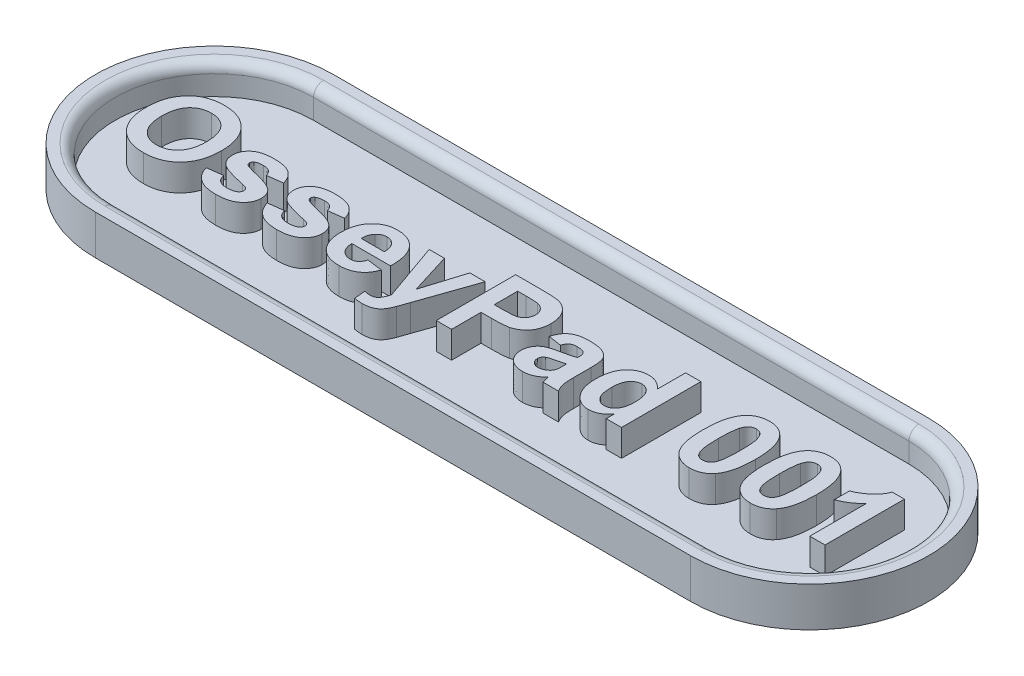
from build123d import *

# Parameters (mm, degrees)
BOSS_EXTRUDE1_DEPTH = 2
CUT_EXTRUDE1_DEPTH  = 1.5
BOSS_EXTRUDE2_DEPTH = 1.35
FILLET1_R           = 0.5


with BuildPart() as part:
    # Sketch1 → Boss-Extrude1 (new body)
    with BuildSketch(Plane(origin=(0, 0, 0), x_dir=(1, 0, 0), z_dir=(0, 1, 0))):
        with BuildLine():
            Line((-15, 6), (15, 6))
            ThreePointArc((15, 6), (21, 0), (15, -6))
            Line((15, -6), (-15, -6))
            ThreePointArc((-15, -6), (-21, 0), (-15, 6))
        make_face()
    extrude(amount=BOSS_EXTRUDE1_DEPTH)

    # Sketch2 → Cut-Extrude1 (cut)
    with BuildSketch(Plane(origin=(0, 2, 0), x_dir=(1, 0, 0), z_dir=(0, 1, 0))):
        with BuildLine():
            Line((-15, 5), (15, 5))
            ThreePointArc((15, 5), (20, 0), (15, -5))
            Line((15, -5), (-15, -5))
            ThreePointArc((-15, -5), (-20, 0), (-15, 5))
        make_face()
    extrude(amount=-CUT_EXTRUDE1_DEPTH, mode=Mode.SUBTRACT)

    # Sketch3 → Boss-Extrude2 (add)
    # profile 1 of 11: a face of its own
    with BuildSketch(Plane(origin=(0, 0.5, 0), x_dir=(1, 0, 0), z_dir=(0, 1, 0))):
        with BuildLine():
            add(Edge.make_bspline(
                [(-18.435897436, -0.019038462), (-18.435614372, 0.030391888), (-18.435058472, 0.127466713), (-18.425426006, 0.269879126), (-18.412729667, 0.406386741), (-18.392053698, 0.536452624), (-18.36773121, 0.660685527), (-18.337310232, 0.779048573), (-18.300663727, 0.891126668), (-18.271511143, 0.96268732), (-18.257211538, 0.997788462)],
                knots=[0, 0, 0, 0, 1.141009212, 2.240794809, 3.294380675, 4.305229195, 5.280013876, 6.216333343, 7.125095522, 8, 8, 8, 8], degree=3))
            add(Edge.make_bspline(
                [(-18.257211538, 0.997788462), (-18.233837113, 1.047688799), (-18.187363182, 1.146902566), (-18.10105379, 1.287099593), (-18.003227182, 1.41931675), (-17.894688739, 1.542860898), (-17.778209481, 1.655872151), (-17.653239913, 1.752593511), (-17.52421983, 1.836291465), (-17.43245726, 1.87838656), (-17.387019231, 1.899230769)],
                knots=[0, 0, 0, 0, 1.031372299, 2.050613973, 3.077158538, 4.108712802, 5.127684358, 6.111366908, 7.06480644, 8, 8, 8, 8], degree=3))
            add(Edge.make_bspline(
                [(-17.387019231, 1.899230769), (-17.356176067, 1.911881947), (-17.293834169, 1.937453202), (-17.196947521, 1.969367469), (-17.09638472, 1.995296368), (-16.992873129, 2.018473783), (-16.885407739, 2.034455374), (-16.774856913, 2.047855388), (-16.660615646, 2.054878568), (-16.583341404, 2.055809135), (-16.544070513, 2.056282051)],
                knots=[0, 0, 0, 0, 0.92659354, 1.872881803, 2.832850937, 3.813025581, 4.820167273, 5.851730198, 6.908245912, 8, 8, 8, 8], degree=3))
            add(Edge.make_bspline(
                [(-16.544070513, 2.056282051), (-16.473752941, 2.054519421), (-16.336140487, 2.051069928), (-16.135127335, 2.026154655), (-15.944907861, 1.984082923), (-15.76612596, 1.923273675), (-15.597240232, 1.847260796), (-15.439562816, 1.752975475), (-15.292860348, 1.641438169), (-15.157416176, 1.51417841), (-15.035438998, 1.371417983), (-14.929207009, 1.214490481), (-14.840092733, 1.044131281), (-14.766701981, 0.860810413), (-14.710306718, 0.663929092), (-14.669561193, 0.454042839), (-14.645355053, 0.230997055), (-14.642494663, 0.077977768), (-14.641025641, -0.000608974)],
                knots=[0, 0, 0, 0, 1.064641025, 2.083517118, 3.061799897, 4.009540929, 4.938075217, 5.861300345, 6.78508344, 7.723570974, 8.670267188, 9.622657076, 10.586935816, 11.576069104, 12.607749008, 13.683335114, 14.81022093, 16, 16, 16, 16], degree=3))
            add(Edge.make_bspline(
                [(-14.641025641, -0.000608974), (-14.642460733, -0.078669488), (-14.645254589, -0.230638725), (-14.669912552, -0.451934259), (-14.708968828, -0.660290436), (-14.766728631, -0.855231293), (-14.837928977, -1.038244361), (-14.927960262, -1.207149806), (-15.031967432, -1.36418805), (-15.153771364, -1.505410123), (-15.286935934, -1.633400225), (-15.433452317, -1.743633941), (-15.589981919, -1.838047013), (-15.757946851, -1.914279558), (-15.936252349, -1.97383646), (-16.125480301, -2.016231483), (-16.325727758, -2.041050879), (-16.462804031, -2.044512896), (-16.532852564, -2.046282051)],
                knots=[0, 0, 0, 0, 1.18845052, 2.313691126, 3.386664782, 4.412527756, 5.405809582, 6.372003093, 7.321919452, 8.268293321, 9.206237639, 10.129603466, 11.054616372, 11.9847576, 12.932764752, 13.912672021, 14.933336461, 16, 16, 16, 16], degree=3))
            add(Edge.make_bspline(
                [(-16.532852564, -2.046282051), (-16.603701235, -2.044508814), (-16.742372437, -2.041038078), (-16.94475572, -2.01629423), (-17.135862082, -1.973885252), (-17.315555438, -1.914118857), (-17.48506133, -1.839044378), (-17.642814776, -1.745596071), (-17.788902977, -1.634664224), (-17.923180215, -1.508180678), (-18.044908831, -1.367373801), (-18.148768325, -1.211345269), (-18.238804305, -1.044089607), (-18.310378988, -0.863073293), (-18.367820729, -0.670158752), (-18.406972441, -0.464235937), (-18.431678084, -0.245871605), (-18.434465278, -0.096031531), (-18.435897436, -0.019038462)],
                knots=[0, 0, 0, 0, 1.080878253, 2.11558926, 3.1052859, 4.062802436, 5.000434901, 5.928596448, 6.853693179, 7.793554778, 8.738606028, 9.68692032, 10.647726704, 11.63151566, 12.651483354, 13.714466703, 14.825613081, 16, 16, 16, 16], degree=3))
        make_face()
        with BuildLine():
            add(Edge.make_bspline(
                [(-17.666666667, 0.007403846), (-17.665898215, -0.047926721), (-17.664410122, -0.155073313), (-17.648559966, -0.310593997), (-17.62450608, -0.455984026), (-17.589131307, -0.591078385), (-17.544442015, -0.715974806), (-17.489688367, -0.830777762), (-17.425096639, -0.935658241), (-17.348996163, -1.028402068), (-17.266661415, -1.111204428), (-17.1777884, -1.182849353), (-17.084033397, -1.244514577), (-16.983774163, -1.293199063), (-16.879097269, -1.331835528), (-16.76918945, -1.360483053), (-16.653504218, -1.376213357), (-16.574563827, -1.378469211), (-16.534455128, -1.379615385)],
                knots=[0, 0, 0, 0, 1.313550922, 2.543666373, 3.708465049, 4.810029406, 5.85539231, 6.85404609, 7.825601258, 8.772642133, 9.696587791, 10.59409323, 11.479048685, 12.35559886, 13.234601248, 14.125357077, 15.047515647, 16, 16, 16, 16], degree=3))
            add(Edge.make_bspline(
                [(-16.534455128, -1.379615385), (-16.494341027, -1.378492434), (-16.415390001, -1.376282287), (-16.299846911, -1.360230356), (-16.189721284, -1.332810725), (-16.08546024, -1.294372249), (-15.986588573, -1.244914713), (-15.8931924, -1.184631894), (-15.80581008, -1.112661016), (-15.723564952, -1.031061566), (-15.649518611, -0.937701745), (-15.585476829, -0.832839365), (-15.530750158, -0.717340126), (-15.486056159, -0.591160819), (-15.451551967, -0.454064039), (-15.428479779, -0.305977248), (-15.412501451, -0.147323872), (-15.411019428, -0.037777837), (-15.41025641, 0.018621795)],
                knots=[0, 0, 0, 0, 0.949153107, 1.868086493, 2.754172764, 3.630100905, 4.492260106, 5.365378617, 6.254840125, 7.166615376, 8.102436631, 9.067266169, 10.06813181, 11.121736829, 12.23011542, 13.408501285, 14.665770308, 16, 16, 16, 16], degree=3))
            add(Edge.make_bspline(
                [(-15.41025641, 0.018621795), (-15.411118249, 0.074476858), (-15.41278728, 0.182645496), (-15.427322822, 0.339296022), (-15.451129355, 0.485035309), (-15.484223065, 0.619825604), (-15.527958483, 0.743688626), (-15.580195321, 0.85696309), (-15.643357078, 0.959057199), (-15.715795873, 1.049918093), (-15.795952736, 1.129893197), (-15.882465829, 1.199907974), (-15.975826687, 1.258164525), (-16.075124125, 1.307179509), (-16.181391931, 1.343543547), (-16.293550177, 1.37006717), (-16.411916263, 1.386400457), (-16.493002947, 1.388527846), (-16.534455128, 1.389615385)],
                knots=[0, 0, 0, 0, 1.332337092, 2.580197383, 3.749299508, 4.852775005, 5.886662144, 6.878700295, 7.822989687, 8.743523536, 9.644687758, 10.519443927, 11.392806431, 12.264866173, 13.155606721, 14.065961015, 15.011303331, 16, 16, 16, 16], degree=3))
            add(Edge.make_bspline(
                [(-16.534455128, 1.389615385), (-16.575912549, 1.388544575), (-16.657009482, 1.38644991), (-16.775560073, 1.369846201), (-16.888071654, 1.344112915), (-16.994324441, 1.305672486), (-17.09448679, 1.257128201), (-17.18818823, 1.196923612), (-17.276167098, 1.127027656), (-17.357042143, 1.045839945), (-17.430654676, 0.954183395), (-17.493846849, 0.850841799), (-17.54773206, 0.736943776), (-17.591941752, 0.612152179), (-17.624714805, 0.476123712), (-17.649903624, 0.32977257), (-17.66404873, 0.17221295), (-17.665775266, 0.063520944), (-17.666666667, 0.007403846)],
                knots=[0, 0, 0, 0, 0.981996942, 1.920933313, 2.83127778, 3.712125466, 4.592427284, 5.463259035, 6.34592384, 7.249932058, 8.173122297, 9.125107726, 10.113123258, 11.154048744, 12.256187849, 13.424658091, 14.670364834, 16, 16, 16, 16], degree=3))
        make_face(mode=Mode.SUBTRACT)
    # profile 2 of 11: a face of its own
    with BuildSketch(Plane(origin=(0, 0.5, 0), x_dir=(1, 0, 0), z_dir=(0, 1, 0))):
        with BuildLine():
            Line((-14.282051282, -1.123205128), (-13.512820513, -1.020641026))
            add(Edge.make_bspline(
                [(-13.512820513, -1.020641026), (-13.503588992, -1.056569262), (-13.485806776, -1.125776019), (-13.440765362, -1.219861636), (-13.384300764, -1.301338096), (-13.313151957, -1.368206503), (-13.227776206, -1.420848967), (-13.126905802, -1.455961432), (-13.011987496, -1.478973479), (-12.930147888, -1.48107304), (-12.887019231, -1.482179487)],
                knots=[0, 0, 0, 0, 1.039319445, 2.001988807, 2.911187514, 3.807680854, 4.723381073, 5.705509029, 6.790826147, 8, 8, 8, 8], degree=3))
            add(Edge.make_bspline(
                [(-12.887019231, -1.482179487), (-12.839880641, -1.481347743), (-12.75121902, -1.479783339), (-12.62828516, -1.458072396), (-12.521475317, -1.427913994), (-12.462819321, -1.391852021), (-12.435096154, -1.374807692)],
                knots=[0, 0, 0, 0, 1.198418162, 2.254070348, 3.174803892, 4, 4, 4, 4], degree=3))
            add(Edge.make_bspline(
                [(-12.435096154, -1.374807692), (-12.419283009, -1.361970451), (-12.388529775, -1.337004722), (-12.357321655, -1.286774029), (-12.336548638, -1.231639984), (-12.33442565, -1.192316164), (-12.333333333, -1.172083333)],
                knots=[0, 0, 0, 0, 1.030872991, 2.004830756, 2.973448591, 4, 4, 4, 4], degree=3))
            add(Edge.make_bspline(
                [(-12.333333333, -1.172083333), (-12.333856942, -1.158391082), (-12.334879677, -1.131646774), (-12.345581427, -1.093401245), (-12.363543317, -1.058834225), (-12.380204244, -1.039316175), (-12.388621795, -1.029455128)],
                knots=[0, 0, 0, 0, 1.045349703, 2.041822997, 3.010676005, 4, 4, 4, 4], degree=3))
            add(Edge.make_bspline(
                [(-12.388621795, -1.029455128), (-12.400894011, -1.020176849), (-12.429419818, -0.998610215), (-12.486486698, -0.974387347), (-12.560350945, -0.950824332), (-12.616066184, -0.937439697), (-12.646634615, -0.930096154)],
                knots=[0, 0, 0, 0, 0.66031085, 1.534841007, 2.647478808, 4, 4, 4, 4], degree=3))
            add(Edge.make_bspline(
                [(-12.646634615, -0.930096154), (-12.721227082, -0.913856878), (-12.863234827, -0.882940846), (-13.065131088, -0.833755569), (-13.245525882, -0.786146435), (-13.404870539, -0.739742648), (-13.542613402, -0.694923944), (-13.658764318, -0.649630758), (-13.754504942, -0.607412605), (-13.808485703, -0.574545067), (-13.832532051, -0.559903846)],
                knots=[0, 0, 0, 0, 1.469089687, 2.796825535, 3.998745421, 5.059265209, 5.990657066, 6.784841839, 7.458693894, 8, 8, 8, 8], degree=3))
            add(Edge.make_bspline(
                [(-13.832532051, -0.559903846), (-13.859964203, -0.539907491), (-13.913524548, -0.500865288), (-13.984866571, -0.433639585), (-14.045359316, -0.360546964), (-14.094819935, -0.281361418), (-14.132571634, -0.196272563), (-14.160176726, -0.105675334), (-14.176162186, -0.00918622), (-14.178365399, 0.057025188), (-14.179487179, 0.090737179)],
                knots=[0, 0, 0, 0, 1.056974227, 2.063706289, 3.045111424, 4.005796011, 4.963194591, 5.937303459, 6.949763919, 8, 8, 8, 8], degree=3))
            add(Edge.make_bspline(
                [(-14.179487179, 0.090737179), (-14.178506217, 0.121498882), (-14.176568673, 0.18225772), (-14.162944075, 0.271321), (-14.139429164, 0.356527801), (-14.106303269, 0.437978804), (-14.063838597, 0.515676427), (-14.01177776, 0.589438857), (-13.95059227, 0.658997097), (-13.880735197, 0.725331941), (-13.800596308, 0.785410533), (-13.709942495, 0.837752256), (-13.608876063, 0.881946689), (-13.497571662, 0.917352533), (-13.376215124, 0.945612476), (-13.244644555, 0.965105296), (-13.102793158, 0.977248281), (-13.004833611, 0.978640938), (-12.954326923, 0.979358974)],
                knots=[0, 0, 0, 0, 0.866638136, 1.711736386, 2.531524902, 3.351865931, 4.183724929, 5.020979167, 5.890357771, 6.790086018, 7.73080449, 8.705352504, 9.73310627, 10.832638366, 11.99182341, 13.240303911, 14.577136024, 16, 16, 16, 16], degree=3))
            add(Edge.make_bspline(
                [(-12.954326923, 0.979358974), (-12.906231226, 0.978787995), (-12.812876493, 0.977679713), (-12.67781573, 0.967920626), (-12.552139255, 0.952611043), (-12.436468928, 0.928745967), (-12.329557347, 0.9011226), (-12.232985185, 0.864147181), (-12.144787817, 0.823597147), (-12.067292993, 0.773348808), (-11.996401025, 0.718487231), (-11.932465755, 0.656484776), (-11.873956769, 0.588615274), (-11.819228994, 0.51594747), (-11.773635709, 0.43487875), (-11.731460942, 0.349008459), (-11.695237781, 0.25654036), (-11.676321498, 0.191859255), (-11.666666667, 0.158846154)],
                knots=[0, 0, 0, 0, 1.380550213, 2.679676202, 3.885648221, 5.011984379, 6.068504557, 7.051214125, 7.977245523, 8.849391706, 9.696088241, 10.547493682, 11.400830533, 12.26732929, 13.153751704, 14.065965736, 15.012872933, 16, 16, 16, 16], degree=3))
            Line((-11.666666667, 0.158846154), (-12.435897436, 0.056282051))
            add(Edge.make_bspline(
                [(-12.435897436, 0.056282051), (-12.44353246, 0.083854631), (-12.458354073, 0.137380345), (-12.494918792, 0.209843608), (-12.540535161, 0.272350335), (-12.59595556, 0.324557028), (-12.662601034, 0.367028168), (-12.742652446, 0.394753661), (-12.834391954, 0.412839487), (-12.899739602, 0.414420424), (-12.934294872, 0.41525641)],
                knots=[0, 0, 0, 0, 1.018425325, 1.977034519, 2.876390575, 3.766006025, 4.677889232, 5.672509542, 6.769243204, 8, 8, 8, 8], degree=3))
            add(Edge.make_bspline(
                [(-12.934294872, 0.41525641), (-12.977124797, 0.414699738), (-13.056725864, 0.413665142), (-13.16586366, 0.397183454), (-13.257824114, 0.374295727), (-13.307346951, 0.345273665), (-13.330128205, 0.331923077)],
                knots=[0, 0, 0, 0, 1.252081424, 2.327041614, 3.230413832, 4, 4, 4, 4], degree=3))
            add(Edge.make_bspline(
                [(-13.330128205, 0.331923077), (-13.342456433, 0.321788731), (-13.366113605, 0.302341495), (-13.391654636, 0.264654654), (-13.407877318, 0.222890209), (-13.409454378, 0.193184234), (-13.41025641, 0.178076923)],
                knots=[0, 0, 0, 0, 1.057832138, 2.029920023, 2.998093444, 4, 4, 4, 4], degree=3))
            add(Edge.make_bspline(
                [(-13.41025641, 0.178076923), (-13.40928165, 0.165135586), (-13.407337559, 0.13932501), (-13.392990107, 0.102271577), (-13.36903332, 0.068392092), (-13.347181778, 0.050453113), (-13.335737179, 0.041057692)],
                knots=[0, 0, 0, 0, 0.958252903, 1.911167308, 2.905987877, 4, 4, 4, 4], degree=3))
            add(Edge.make_bspline(
                [(-13.335737179, 0.041057692), (-13.32494537, 0.034084736), (-13.299162077, 0.01742527), (-13.249511898, -0.002773967), (-13.18505873, -0.026047872), (-13.104980233, -0.051235356), (-13.009711848, -0.079347287), (-12.89880707, -0.10890514), (-12.772311342, -0.139825148), (-12.634515803, -0.17219658), (-12.49437076, -0.205708932), (-12.361338797, -0.242193781), (-12.239728485, -0.281613621), (-12.129457938, -0.322826732), (-12.030304296, -0.366366142), (-11.942020126, -0.41061892), (-11.864871621, -0.457567942), (-11.820191691, -0.493218242), (-11.798878205, -0.510224359)],
                knots=[0, 0, 0, 0, 0.374473465, 0.894674728, 1.558250729, 2.377018991, 3.344303564, 4.458456515, 5.727543487, 7.146141891, 8.591136569, 9.934411183, 11.172377707, 12.322386231, 13.369924362, 14.332482298, 15.204550818, 16, 16, 16, 16], degree=3))
            add(Edge.make_bspline(
                [(-11.798878205, -0.510224359), (-11.779945602, -0.527644828), (-11.742536172, -0.562066393), (-11.69542515, -0.621833436), (-11.653661961, -0.685071569), (-11.621326792, -0.754462947), (-11.595250362, -0.828189433), (-11.576771333, -0.907148599), (-11.566753507, -0.991269367), (-11.564997898, -1.048928191), (-11.564102564, -1.078333333)],
                knots=[0, 0, 0, 0, 0.971012965, 1.9186502, 2.868006896, 3.82989672, 4.803792202, 5.820095146, 6.888280979, 8, 8, 8, 8], degree=3))
            add(Edge.make_bspline(
                [(-11.564102564, -1.078333333), (-11.565295587, -1.110969704), (-11.567645823, -1.175262837), (-11.582875331, -1.270113279), (-11.609989246, -1.360922238), (-11.645666238, -1.449065327), (-11.693816672, -1.532829726), (-11.751948954, -1.613022854), (-11.819518303, -1.690582731), (-11.897996412, -1.763354566), (-11.987072109, -1.829811392), (-12.085901593, -1.888678871), (-12.195218434, -1.937522003), (-12.314399095, -1.977516026), (-12.443694139, -2.008375551), (-12.582931045, -2.030888881), (-12.732147542, -2.043256241), (-12.834914261, -2.045253714), (-12.887820513, -2.046282051)],
                knots=[0, 0, 0, 0, 0.853005228, 1.680406763, 2.502135431, 3.325285981, 4.159928718, 5.020072903, 5.910500533, 6.844018396, 7.811498054, 8.809909951, 9.84399402, 10.934451331, 12.090792638, 13.314110396, 14.617253208, 16, 16, 16, 16], degree=3))
            add(Edge.make_bspline(
                [(-12.887820513, -2.046282051), (-12.936181474, -2.045452418), (-13.030366908, -2.043836665), (-13.167786588, -2.03305919), (-13.29724265, -2.0126671), (-13.419121567, -1.98570948), (-13.533495342, -1.951546885), (-13.639918269, -1.908814847), (-13.738889811, -1.858532218), (-13.829524457, -1.799749942), (-13.912359977, -1.734491454), (-13.987982542, -1.66375026), (-14.056500913, -1.587622814), (-14.116484012, -1.50536249), (-14.170071844, -1.418252796), (-14.215427969, -1.325350699), (-14.253759352, -1.226740298), (-14.27251028, -1.158120713), (-14.282051282, -1.123205128)],
                knots=[0, 0, 0, 0, 1.275954772, 2.484986887, 3.63311568, 4.730696379, 5.776212371, 6.778566547, 7.752400714, 8.700396387, 9.623767345, 10.531135067, 11.42942751, 12.321590653, 13.213503293, 14.124285009, 15.045583181, 16, 16, 16, 16], degree=3))
        make_face()
    # profile 3 of 11: a face of its own
    with BuildSketch(Plane(origin=(0, 0.5, 0), x_dir=(1, 0, 0), z_dir=(0, 1, 0))):
        with BuildLine():
            Line((-11.205128205, -1.123205128), (-10.435897436, -1.020641026))
            add(Edge.make_bspline(
                [(-10.435897436, -1.020641026), (-10.426665915, -1.056569262), (-10.408883699, -1.125776019), (-10.363842285, -1.219861636), (-10.307377687, -1.301338096), (-10.23622888, -1.368206503), (-10.150853129, -1.420848967), (-10.049982725, -1.455961432), (-9.935064419, -1.478973479), (-9.853224811, -1.48107304), (-9.810096154, -1.482179487)],
                knots=[0, 0, 0, 0, 1.039319445, 2.001988807, 2.911187514, 3.807680854, 4.723381073, 5.705509029, 6.790826147, 8, 8, 8, 8], degree=3))
            add(Edge.make_bspline(
                [(-9.810096154, -1.482179487), (-9.762957564, -1.481347743), (-9.674295943, -1.479783339), (-9.551362083, -1.458072396), (-9.44455224, -1.427913994), (-9.385896244, -1.391852021), (-9.358173077, -1.374807692)],
                knots=[0, 0, 0, 0, 1.198418162, 2.254070348, 3.174803892, 4, 4, 4, 4], degree=3))
            add(Edge.make_bspline(
                [(-9.358173077, -1.374807692), (-9.342359932, -1.361970451), (-9.311606698, -1.337004722), (-9.280398578, -1.286774029), (-9.259625561, -1.231639984), (-9.257502573, -1.192316164), (-9.256410256, -1.172083333)],
                knots=[0, 0, 0, 0, 1.030872991, 2.004830756, 2.973448591, 4, 4, 4, 4], degree=3))
            add(Edge.make_bspline(
                [(-9.256410256, -1.172083333), (-9.256933865, -1.158391082), (-9.2579566, -1.131646774), (-9.26865835, -1.093401245), (-9.28662024, -1.058834225), (-9.303281167, -1.039316175), (-9.311698718, -1.029455128)],
                knots=[0, 0, 0, 0, 1.045349703, 2.041822997, 3.010676005, 4, 4, 4, 4], degree=3))
            add(Edge.make_bspline(
                [(-9.311698718, -1.029455128), (-9.323970934, -1.020176849), (-9.352496741, -0.998610215), (-9.409563621, -0.974387347), (-9.483427868, -0.950824332), (-9.539143107, -0.937439697), (-9.569711538, -0.930096154)],
                knots=[0, 0, 0, 0, 0.66031085, 1.534841007, 2.647478808, 4, 4, 4, 4], degree=3))
            add(Edge.make_bspline(
                [(-9.569711538, -0.930096154), (-9.644304005, -0.913856878), (-9.78631175, -0.882940846), (-9.988208011, -0.833755569), (-10.168602805, -0.786146435), (-10.327947462, -0.739742648), (-10.465690325, -0.694923944), (-10.581841241, -0.649630758), (-10.677581865, -0.607412605), (-10.731562627, -0.574545067), (-10.755608974, -0.559903846)],
                knots=[0, 0, 0, 0, 1.469089687, 2.796825535, 3.998745421, 5.059265209, 5.990657066, 6.784841839, 7.458693894, 8, 8, 8, 8], degree=3))
            add(Edge.make_bspline(
                [(-10.755608974, -0.559903846), (-10.783041126, -0.539907491), (-10.836601471, -0.500865288), (-10.907943494, -0.433639585), (-10.968436239, -0.360546964), (-11.017896858, -0.281361418), (-11.055648557, -0.196272563), (-11.083253649, -0.105675334), (-11.09923911, -0.00918622), (-11.101442322, 0.057025188), (-11.102564103, 0.090737179)],
                knots=[0, 0, 0, 0, 1.056974227, 2.063706289, 3.045111424, 4.005796011, 4.963194591, 5.937303459, 6.949763919, 8, 8, 8, 8], degree=3))
            add(Edge.make_bspline(
                [(-11.102564103, 0.090737179), (-11.10158314, 0.121498882), (-11.099645596, 0.18225772), (-11.086020998, 0.271321), (-11.062506087, 0.356527801), (-11.029380192, 0.437978804), (-10.98691552, 0.515676427), (-10.934854683, 0.589438857), (-10.873669193, 0.658997097), (-10.80381212, 0.725331941), (-10.723673231, 0.785410533), (-10.633019418, 0.837752256), (-10.531952987, 0.881946689), (-10.420648585, 0.917352533), (-10.299292047, 0.945612476), (-10.167721478, 0.965105296), (-10.025870081, 0.977248281), (-9.927910534, 0.978640938), (-9.877403846, 0.979358974)],
                knots=[0, 0, 0, 0, 0.866638136, 1.711736386, 2.531524902, 3.351865931, 4.183724929, 5.020979167, 5.890357771, 6.790086018, 7.73080449, 8.705352504, 9.73310627, 10.832638366, 11.99182341, 13.240303911, 14.577136024, 16, 16, 16, 16], degree=3))
            add(Edge.make_bspline(
                [(-9.877403846, 0.979358974), (-9.829308149, 0.978787995), (-9.735953416, 0.977679713), (-9.600892653, 0.967920626), (-9.475216179, 0.952611043), (-9.359545852, 0.928745967), (-9.252634271, 0.9011226), (-9.156062108, 0.864147181), (-9.06786474, 0.823597147), (-8.990369916, 0.773348808), (-8.919477948, 0.718487231), (-8.855542678, 0.656484776), (-8.797033692, 0.588615274), (-8.742305917, 0.51594747), (-8.696712633, 0.43487875), (-8.654537865, 0.349008459), (-8.618314704, 0.25654036), (-8.599398421, 0.191859255), (-8.58974359, 0.158846154)],
                knots=[0, 0, 0, 0, 1.380550213, 2.679676202, 3.885648221, 5.011984379, 6.068504557, 7.051214125, 7.977245523, 8.849391706, 9.696088241, 10.547493682, 11.400830533, 12.26732929, 13.153751704, 14.065965736, 15.012872933, 16, 16, 16, 16], degree=3))
            Line((-8.58974359, 0.158846154), (-9.358974359, 0.056282051))
            add(Edge.make_bspline(
                [(-9.358974359, 0.056282051), (-9.366609383, 0.083854631), (-9.381430996, 0.137380345), (-9.417995715, 0.209843608), (-9.463612084, 0.272350335), (-9.519032483, 0.324557028), (-9.585677957, 0.367028168), (-9.665729369, 0.394753661), (-9.757468877, 0.412839487), (-9.822816525, 0.414420424), (-9.857371795, 0.41525641)],
                knots=[0, 0, 0, 0, 1.018425325, 1.977034519, 2.876390575, 3.766006025, 4.677889232, 5.672509542, 6.769243204, 8, 8, 8, 8], degree=3))
            add(Edge.make_bspline(
                [(-9.857371795, 0.41525641), (-9.90020172, 0.414699738), (-9.979802787, 0.413665142), (-10.088940583, 0.397183454), (-10.180901037, 0.374295727), (-10.230423874, 0.345273665), (-10.253205128, 0.331923077)],
                knots=[0, 0, 0, 0, 1.252081424, 2.327041614, 3.230413832, 4, 4, 4, 4], degree=3))
            add(Edge.make_bspline(
                [(-10.253205128, 0.331923077), (-10.265533356, 0.321788731), (-10.289190529, 0.302341495), (-10.314731559, 0.264654654), (-10.330954241, 0.222890209), (-10.332531301, 0.193184234), (-10.333333333, 0.178076923)],
                knots=[0, 0, 0, 0, 1.057832138, 2.029920023, 2.998093444, 4, 4, 4, 4], degree=3))
            add(Edge.make_bspline(
                [(-10.333333333, 0.178076923), (-10.332358573, 0.165135586), (-10.330414482, 0.13932501), (-10.31606703, 0.102271577), (-10.292110243, 0.068392092), (-10.270258701, 0.050453113), (-10.258814103, 0.041057692)],
                knots=[0, 0, 0, 0, 0.958252903, 1.911167308, 2.905987877, 4, 4, 4, 4], degree=3))
            add(Edge.make_bspline(
                [(-10.258814103, 0.041057692), (-10.248022293, 0.034084736), (-10.222239, 0.01742527), (-10.172588821, -0.002773967), (-10.108135653, -0.026047872), (-10.028057156, -0.051235356), (-9.932788771, -0.079347287), (-9.821883993, -0.10890514), (-9.695388266, -0.139825148), (-9.557592726, -0.17219658), (-9.417447683, -0.205708932), (-9.28441572, -0.242193781), (-9.162805408, -0.281613621), (-9.052534861, -0.322826732), (-8.953381219, -0.366366142), (-8.865097049, -0.41061892), (-8.787948544, -0.457567942), (-8.743268614, -0.493218242), (-8.721955128, -0.510224359)],
                knots=[0, 0, 0, 0, 0.374473465, 0.894674728, 1.558250729, 2.377018991, 3.344303564, 4.458456515, 5.727543487, 7.146141891, 8.591136569, 9.934411183, 11.172377707, 12.322386231, 13.369924362, 14.332482298, 15.204550818, 16, 16, 16, 16], degree=3))
            add(Edge.make_bspline(
                [(-8.721955128, -0.510224359), (-8.703022526, -0.527644828), (-8.665613095, -0.562066393), (-8.618502073, -0.621833436), (-8.576738884, -0.685071569), (-8.544403716, -0.754462947), (-8.518327285, -0.828189433), (-8.499848256, -0.907148599), (-8.48983043, -0.991269367), (-8.488074821, -1.048928191), (-8.487179487, -1.078333333)],
                knots=[0, 0, 0, 0, 0.971012965, 1.9186502, 2.868006896, 3.82989672, 4.803792202, 5.820095146, 6.888280979, 8, 8, 8, 8], degree=3))
            add(Edge.make_bspline(
                [(-8.487179487, -1.078333333), (-8.48837251, -1.110969704), (-8.490722746, -1.175262837), (-8.505952254, -1.270113279), (-8.533066169, -1.360922238), (-8.568743161, -1.449065327), (-8.616893595, -1.532829726), (-8.675025877, -1.613022854), (-8.742595226, -1.690582731), (-8.821073335, -1.763354566), (-8.910149032, -1.829811392), (-9.008978516, -1.888678871), (-9.118295357, -1.937522003), (-9.237476018, -1.977516026), (-9.366771062, -2.008375551), (-9.506007968, -2.030888881), (-9.655224465, -2.043256241), (-9.757991184, -2.045253714), (-9.810897436, -2.046282051)],
                knots=[0, 0, 0, 0, 0.853005228, 1.680406763, 2.502135431, 3.325285981, 4.159928718, 5.020072903, 5.910500533, 6.844018396, 7.811498054, 8.809909951, 9.84399402, 10.934451331, 12.090792638, 13.314110396, 14.617253208, 16, 16, 16, 16], degree=3))
            add(Edge.make_bspline(
                [(-9.810897436, -2.046282051), (-9.859258397, -2.045452418), (-9.953443831, -2.043836665), (-10.090863511, -2.03305919), (-10.220319573, -2.0126671), (-10.34219849, -1.98570948), (-10.456572265, -1.951546885), (-10.562995193, -1.908814847), (-10.661966734, -1.858532218), (-10.75260138, -1.799749942), (-10.8354369, -1.734491454), (-10.911059465, -1.66375026), (-10.979577836, -1.587622814), (-11.039560935, -1.50536249), (-11.093148767, -1.418252796), (-11.138504892, -1.325350699), (-11.176836275, -1.226740298), (-11.195587203, -1.158120713), (-11.205128205, -1.123205128)],
                knots=[0, 0, 0, 0, 1.275954772, 2.484986887, 3.63311568, 4.730696379, 5.776212371, 6.778566547, 7.752400714, 8.700396387, 9.623767345, 10.531135067, 11.42942751, 12.321590653, 13.213503293, 14.124285009, 15.045583181, 16, 16, 16, 16], degree=3))
        make_face()
    # profile 4 of 11: a face of its own
    with BuildSketch(Plane(origin=(0, 0.5, 0), x_dir=(1, 0, 0), z_dir=(0, 1, 0))):
        with BuildLine():
            Line((-6.179487179, -1.071923077), (-5.41025641, -1.174487179))
            add(Edge.make_bspline(
                [(-5.41025641, -1.174487179), (-5.422838254, -1.20914502), (-5.447576842, -1.277289721), (-5.492774404, -1.374455858), (-5.543296381, -1.465142319), (-5.598899889, -1.549833641), (-5.659377993, -1.62864032), (-5.726730472, -1.699904598), (-5.797676228, -1.766279406), (-5.875182892, -1.824604191), (-5.957308426, -1.87705751), (-6.044465549, -1.922953609), (-6.137351275, -1.960331891), (-6.234559014, -1.991633673), (-6.336530004, -2.016618795), (-6.443680264, -2.034085851), (-6.555872325, -2.04469832), (-6.632454789, -2.045747489), (-6.671474359, -2.046282051)],
                knots=[0, 0, 0, 0, 1.071172907, 2.106154283, 3.1104349, 4.085737425, 5.048416355, 5.993087888, 6.932482331, 7.868664062, 8.80754521, 9.762367971, 10.726735429, 11.713584758, 12.728370439, 13.774815933, 14.866245336, 16, 16, 16, 16], degree=3))
            add(Edge.make_bspline(
                [(-6.671474359, -2.046282051), (-6.73244897, -2.044777084), (-6.850857026, -2.041854553), (-7.022165966, -2.018368995), (-7.181275551, -1.980131589), (-7.32849222, -1.926572657), (-7.463326656, -1.856316779), (-7.585981892, -1.770887167), (-7.696698473, -1.670098154), (-7.758755291, -1.592062658), (-7.790064103, -1.552692308)],
                knots=[0, 0, 0, 0, 1.150944905, 2.235047425, 3.25761485, 4.235688044, 5.185329112, 6.119879054, 7.051444229, 8, 8, 8, 8], degree=3))
            add(Edge.make_bspline(
                [(-7.790064103, -1.552692308), (-7.813170014, -1.519188378), (-7.859698573, -1.451721244), (-7.917535282, -1.34240076), (-7.966990504, -1.226915415), (-8.006389648, -1.10493441), (-8.039141254, -0.976921214), (-8.061176981, -0.842062561), (-8.073877703, -0.700641464), (-8.075894219, -0.604267599), (-8.076923077, -0.555096154)],
                knots=[0, 0, 0, 0, 0.92479112, 1.862259343, 2.806490716, 3.778329015, 4.774107667, 5.808532634, 6.881879269, 8, 8, 8, 8], degree=3))
            add(Edge.make_bspline(
                [(-8.076923077, -0.555096154), (-8.076076915, -0.49680785), (-8.07442276, -0.382860481), (-8.054838894, -0.217220041), (-8.027204936, -0.060584792), (-7.985061289, 0.085417992), (-7.932387367, 0.22245377), (-7.866279548, 0.34876033), (-7.790026011, 0.466635164), (-7.7008682, 0.572518319), (-7.603162134, 0.667723886), (-7.499184551, 0.751615965), (-7.388157067, 0.821688048), (-7.271733408, 0.880173442), (-7.14797637, 0.923951058), (-7.018434887, 0.956177131), (-6.882542557, 0.975802375), (-6.789861762, 0.978161007), (-6.742788462, 0.979358974)],
                knots=[0, 0, 0, 0, 1.222152375, 2.389176539, 3.494777592, 4.555389183, 5.572001132, 6.56945427, 7.540785438, 8.511469914, 9.46642023, 10.399267108, 11.30862844, 12.215760073, 13.126777173, 14.056336669, 15.012798191, 16, 16, 16, 16], degree=3))
            add(Edge.make_bspline(
                [(-6.742788462, 0.979358974), (-6.690103883, 0.978245071), (-6.587005685, 0.976065279), (-6.436688886, 0.9556016), (-6.294763964, 0.922316944), (-6.161694515, 0.874488801), (-6.036612813, 0.814514631), (-5.920449133, 0.740188756), (-5.813197512, 0.652189942), (-5.715122809, 0.55055571), (-5.626363532, 0.43595435), (-5.550815549, 0.306175293), (-5.487571448, 0.162559914), (-5.436298601, 0.004737951), (-5.398393184, -0.167620997), (-5.372456715, -0.354068383), (-5.357665573, -0.554587098), (-5.358529001, -0.692892511), (-5.358974359, -0.764230769)],
                knots=[0, 0, 0, 0, 0.994942504, 1.946998194, 2.860087576, 3.744358974, 4.613292, 5.475605888, 6.343365869, 7.228414471, 8.138836547, 9.075277299, 10.058013037, 11.098483422, 12.205225682, 13.387753975, 14.652597341, 16, 16, 16, 16], degree=3))
            Line((-5.358974359, -0.764230769), (-7.307692308, -0.764230769))
            add(Edge.make_bspline(
                [(-7.307692308, -0.764230769), (-7.306430775, -0.791763508), (-7.303974166, -0.845378582), (-7.294668746, -0.923749334), (-7.278559473, -0.997107978), (-7.257477652, -1.065899573), (-7.232409314, -1.130172389), (-7.200520404, -1.189309247), (-7.16378028, -1.244064576), (-7.121306381, -1.293545478), (-7.074800926, -1.33746997), (-7.0257272, -1.376071275), (-6.974160527, -1.409825053), (-6.918768647, -1.435496954), (-6.861393173, -1.45717398), (-6.801001234, -1.47106864), (-6.737997051, -1.480301614), (-6.69501317, -1.481544961), (-6.673076923, -1.482179487)],
                knots=[0, 0, 0, 0, 1.231756261, 2.398624542, 3.522625857, 4.583815436, 5.612473245, 6.600564899, 7.580690863, 8.554470542, 9.508734211, 10.435415665, 11.342824763, 12.255949018, 13.158633635, 14.07945191, 15.019874036, 16, 16, 16, 16], degree=3))
            add(Edge.make_bspline(
                [(-6.673076923, -1.482179487), (-6.64387994, -1.48088488), (-6.587329742, -1.47837742), (-6.505816434, -1.460808928), (-6.431856781, -1.429848571), (-6.364675803, -1.38668616), (-6.304898113, -1.329366423), (-6.254780714, -1.256358155), (-6.210961635, -1.169940595), (-6.190323861, -1.10567059), (-6.179487179, -1.071923077)],
                knots=[0, 0, 0, 0, 1.004430367, 1.945431754, 2.851730883, 3.749038912, 4.678525969, 5.68064125, 6.782128749, 8, 8, 8, 8], degree=3))
        make_face()
        with BuildLine():
            add(Edge.make_bspline(
                [(-6.128205128, -0.302692308), (-6.129529022, -0.27436421), (-6.132107398, -0.219193261), (-6.140517974, -0.138754154), (-6.154956078, -0.063779133), (-6.173946423, 0.006136145), (-6.19928545, 0.070130996), (-6.227575235, 0.130039606), (-6.262269047, 0.183996564), (-6.302011352, 0.231877901), (-6.343933295, 0.275642987), (-6.390274279, 0.312036491), (-6.437130475, 0.344605938), (-6.486925478, 0.370666995), (-6.539143428, 0.390577661), (-6.593608472, 0.405216492), (-6.650415746, 0.413060596), (-6.688813985, 0.414516378), (-6.708333333, 0.41525641)],
                knots=[0, 0, 0, 0, 1.317025077, 2.564998298, 3.752245872, 4.859831213, 5.924126069, 6.944952788, 7.932526842, 8.893486968, 9.832088588, 10.740700482, 11.624936399, 12.479435602, 13.343337491, 14.21592381, 15.09308328, 16, 16, 16, 16], degree=3))
            add(Edge.make_bspline(
                [(-6.708333333, 0.41525641), (-6.729193143, 0.414579294), (-6.770298439, 0.413245004), (-6.830578131, 0.404539004), (-6.887714451, 0.389097395), (-6.942142836, 0.368197959), (-6.993746644, 0.340675591), (-7.042527028, 0.3069228), (-7.088667506, 0.267362169), (-7.116469259, 0.237390667), (-7.130608974, 0.222147436)],
                knots=[0, 0, 0, 0, 1.043516863, 2.056302107, 3.038302912, 3.998520634, 4.966791607, 5.956307719, 6.960596886, 8, 8, 8, 8], degree=3))
            add(Edge.make_bspline(
                [(-7.130608974, 0.222147436), (-7.143788139, 0.20557584), (-7.170266724, 0.172281439), (-7.203849377, 0.117077998), (-7.2331022, 0.058071984), (-7.25490191, -0.006329707), (-7.274046479, -0.074039953), (-7.285276565, -0.146676948), (-7.29284166, -0.223201483), (-7.293653159, -0.275694916), (-7.294070513, -0.302692308)],
                knots=[0, 0, 0, 0, 0.903873942, 1.815995408, 2.755131859, 3.711650387, 4.716574161, 5.757841734, 6.846857195, 8, 8, 8, 8], degree=3))
            Line((-7.294070513, -0.302692308), (-6.128205128, -0.302692308))
        make_face(mode=Mode.SUBTRACT)
    # profile 5 of 11: a face of its own
    with BuildSketch(Plane(origin=(0, 0.5, 0), x_dir=(1, 0, 0), z_dir=(0, 1, 0))):
        with BuildLine():
            Line((-5.102564103, 0.928076923), (-4.333333333, 0.928076923))
            Line((-4.333333333, 0.928076923), (-3.692307692, -1.141634615))
            Line((-3.692307692, -1.141634615), (-3.051282051, 0.928076923))
            Line((-3.051282051, 0.928076923), (-2.282051282, 0.928076923))
            Line((-2.282051282, 0.928076923), (-3.25400641, -1.859583333))
            Line((-3.25400641, -1.859583333), (-3.438301282, -2.387628205))
            add(Edge.make_bspline(
                [(-3.438301282, -2.387628205), (-3.453456537, -2.425433559), (-3.481955479, -2.496525243), (-3.527377153, -2.595048236), (-3.570270905, -2.680032392), (-3.614950884, -2.751152619), (-3.65860382, -2.813347921), (-3.706447973, -2.866730369), (-3.756200941, -2.915660081), (-3.810255711, -2.958249565), (-3.869204212, -2.996023695), (-3.934189839, -3.02829271), (-4.005183048, -3.057739725), (-4.082622109, -3.080954513), (-4.16540167, -3.100958742), (-4.253787045, -3.112508809), (-4.347000031, -3.122486853), (-4.411026321, -3.1229614), (-4.443910256, -3.123205128)],
                knots=[0, 0, 0, 0, 1.442389574, 2.712364636, 3.842141792, 4.810870158, 5.685193676, 6.529785669, 7.346031511, 8.154233153, 8.962545531, 9.821428725, 10.720930479, 11.681493955, 12.682037037, 13.733651981, 14.836002494, 16, 16, 16, 16], degree=3))
            add(Edge.make_bspline(
                [(-4.443910256, -3.123205128), (-4.51167732, -3.121551977), (-4.646906127, -3.118253122), (-4.779837985, -3.093223656), (-4.846153846, -3.080737179)],
                knots=[0, 0, 0, 0, 1.002257816, 2, 2, 2, 2], degree=3))
            Line((-4.846153846, -3.080737179), (-4.897435897, -2.523044872))
            add(Edge.make_bspline(
                [(-4.897435897, -2.523044872), (-4.871045551, -2.528661351), (-4.820081387, -2.539507709), (-4.744920908, -2.550843403), (-4.67372872, -2.557389476), (-4.627415917, -2.558543301), (-4.604967949, -2.559102564)],
                knots=[0, 0, 0, 0, 1.096454798, 2.117437249, 3.087515614, 4, 4, 4, 4], degree=3))
            add(Edge.make_bspline(
                [(-4.604967949, -2.559102564), (-4.585448017, -2.55866928), (-4.547866863, -2.557835092), (-4.493278414, -2.550632323), (-4.442750478, -2.537863287), (-4.396168166, -2.520008384), (-4.352850548, -2.498612294), (-4.314003999, -2.470696751), (-4.278879333, -2.438189335), (-4.237571333, -2.386996495), (-4.192014185, -2.314596413), (-4.145094126, -2.217843648), (-4.103775694, -2.110670578), (-4.082920852, -2.03447765), (-4.072115385, -1.995)],
                knots=[0, 0, 0, 0, 0.826282398, 1.5908173, 2.325927711, 3.027474672, 3.700169566, 4.365407898, 5.04557163, 5.720354759, 7.144619778, 8.656909909, 10.267853154, 12, 12, 12, 12], degree=3))
            Line((-4.072115385, -1.995), (-5.102564103, 0.928076923))
        make_face()
    # profile 6 of 11: a face of its own
    with BuildSketch(Plane(origin=(0, 0.5, 0), x_dir=(1, 0, 0), z_dir=(0, 1, 0))):
        with BuildLine():
            Line((-1.820512821, -1.995), (-1.820512821, 2.005))
            Line((-1.820512821, 2.005), (-0.540865385, 2.005))
            add(Edge.make_bspline(
                [(-0.540865385, 2.005), (-0.482904088, 2.004936704), (-0.372046219, 2.004815641), (-0.213914173, 2.001452031), (-0.071539957, 1.99669047), (0.054865123, 1.990760147), (0.165745855, 1.981910965), (0.260604839, 1.971663747), (0.340039396, 1.960640459), (0.386816053, 1.94923283), (0.407852564, 1.944102564)],
                knots=[0, 0, 0, 0, 1.460485487, 2.793352117, 3.985295279, 5.050041172, 5.981765236, 6.787433016, 7.454681457, 8, 8, 8, 8], degree=3))
            add(Edge.make_bspline(
                [(0.407852564, 1.944102564), (0.435826008, 1.936126257), (0.491346741, 1.920295157), (0.570890637, 1.886545765), (0.647558357, 1.847432021), (0.720386654, 1.800815508), (0.789623093, 1.747523834), (0.855473477, 1.6879916), (0.918288976, 1.621950063), (0.977200619, 1.549529687), (1.031156753, 1.471095651), (1.077788411, 1.386531993), (1.116855989, 1.296206269), (1.150140917, 1.200797267), (1.174698695, 1.099282048), (1.191884675, 0.992365949), (1.203848261, 0.880002209), (1.20469532, 0.80310963), (1.205128205, 0.763814103)],
                knots=[0, 0, 0, 0, 0.907145743, 1.80047177, 2.69161667, 3.591261238, 4.495029544, 5.415863088, 6.359363025, 7.337192411, 8.326890979, 9.326929023, 10.346104993, 11.395420813, 12.477187422, 13.601053412, 14.774031606, 16, 16, 16, 16], degree=3))
            add(Edge.make_bspline(
                [(1.205128205, 0.763814103), (1.20389362, 0.704139376), (1.201516976, 0.589262252), (1.174926543, 0.42457197), (1.134369593, 0.274138014), (1.075092679, 0.139409376), (1.002821807, 0.019857357), (0.923213954, -0.087918223), (0.832313485, -0.180668899), (0.734103546, -0.259891497), (0.63031359, -0.324723985), (0.526335754, -0.37999276), (0.420767007, -0.422485161), (0.348790471, -0.440999441), (0.313301282, -0.450128205)],
                knots=[0, 0, 0, 0, 1.312386234, 2.526415563, 3.661883817, 4.733421185, 5.753802465, 6.732107337, 7.675884281, 8.604170108, 9.50284679, 10.365392406, 11.194030444, 12, 12, 12, 12], degree=3))
            add(Edge.make_bspline(
                [(0.313301282, -0.450128205), (0.28797084, -0.454946651), (0.23457729, -0.465103359), (0.149898314, -0.475227748), (0.057339603, -0.486434343), (-0.043479541, -0.493743914), (-0.152437155, -0.500589021), (-0.26949093, -0.503820822), (-0.394473583, -0.507714485), (-0.480498279, -0.50778445), (-0.524839744, -0.507820513)],
                knots=[0, 0, 0, 0, 0.735353946, 1.55003838, 2.431865514, 3.394945452, 4.432993119, 5.54609699, 6.735134699, 8, 8, 8, 8], degree=3))
            Line((-0.524839744, -0.507820513), (-1.051282051, -0.507820513))
            Line((-1.051282051, -0.507820513), (-1.051282051, -1.995))
            Line((-1.051282051, -1.995), (-1.820512821, -1.995))
        make_face()
        with BuildLine():
            Line((-1.051282051, 1.338333333), (-1.051282051, 0.158846154))
            Line((-1.051282051, 0.158846154), (-0.58974359, 0.158846154))
            add(Edge.make_bspline(
                [(-0.58974359, 0.158846154), (-0.549943086, 0.158897692), (-0.473799714, 0.158996291), (-0.364550866, 0.162535426), (-0.265658705, 0.166855596), (-0.1769166, 0.174006361), (-0.098860221, 0.183430898), (-0.030966844, 0.194703832), (0.026842659, 0.206800867), (0.089355767, 0.226847594), (0.156194777, 0.259281369), (0.227570985, 0.305896851), (0.2902749, 0.361631158), (0.342452868, 0.427089171), (0.384131512, 0.499816815), (0.413973452, 0.579068755), (0.433242364, 0.663531508), (0.435002404, 0.722041046), (0.435897436, 0.751794872)],
                knots=[0, 0, 0, 0, 1.411705958, 2.700771114, 3.876961699, 4.922619712, 5.858038221, 6.66485904, 7.363650596, 7.950905807, 8.989198271, 9.987739806, 10.967313358, 11.951275539, 12.944273208, 13.927870418, 14.946261014, 16, 16, 16, 16], degree=3))
            add(Edge.make_bspline(
                [(0.435897436, 0.751794872), (0.434637777, 0.788034566), (0.432195463, 0.858298556), (0.405263565, 0.958366204), (0.363710723, 1.049178808), (0.304301956, 1.127910777), (0.232537565, 1.194117889), (0.151877383, 1.249204559), (0.060598878, 1.287754631), (-0.004001838, 1.302691361), (-0.036858974, 1.310288462)],
                knots=[0, 0, 0, 0, 1.085904563, 2.105425768, 3.088705091, 4.068969419, 5.045188284, 6.010769642, 6.988240112, 8, 8, 8, 8], degree=3))
            add(Edge.make_bspline(
                [(-0.036858974, 1.310288462), (-0.050998151, 1.312549908), (-0.082382739, 1.317569616), (-0.134550311, 1.322808307), (-0.196264557, 1.327572891), (-0.267599868, 1.331484756), (-0.348273487, 1.33454293), (-0.438551514, 1.337222643), (-0.538196183, 1.337437923), (-0.607906635, 1.338026594), (-0.644230769, 1.338333333)],
                knots=[0, 0, 0, 0, 0.564603001, 1.253243608, 2.066786758, 3.005752288, 4.070476343, 5.250658742, 6.567396469, 8, 8, 8, 8], degree=3))
            Line((-0.644230769, 1.338333333), (-1.051282051, 1.338333333))
        make_face(mode=Mode.SUBTRACT)
    # profile 7 of 11: a face of its own
    with BuildSketch(Plane(origin=(0, 0.5, 0), x_dir=(1, 0, 0), z_dir=(0, 1, 0))):
        with BuildLine():
            Line((2.384615385, 0.056282051), (1.717948718, 0.158846154))
            add(Edge.make_bspline(
                [(1.717948718, 0.158846154), (1.727939679, 0.192636215), (1.747496781, 0.258779572), (1.783384379, 0.353563601), (1.825408393, 0.441191354), (1.87175492, 0.522709688), (1.923852054, 0.597227449), (1.980867125, 0.664938486), (2.043122358, 0.725611059), (2.110915284, 0.779714879), (2.185550169, 0.827777413), (2.268721238, 0.868524876), (2.36030384, 0.90283482), (2.46016939, 0.930407994), (2.568150339, 0.953460233), (2.685073192, 0.967572466), (2.810183814, 0.977759307), (2.896344251, 0.978815288), (2.940705128, 0.979358974)],
                knots=[0, 0, 0, 0, 1.047140172, 2.049755565, 3.008539736, 3.933190086, 4.833981818, 5.707167246, 6.560530269, 7.413560864, 8.281243119, 9.193714071, 10.161006392, 11.183910126, 12.270717139, 13.439589873, 14.681737877, 16, 16, 16, 16], degree=3))
            add(Edge.make_bspline(
                [(2.940705128, 0.979358974), (2.981043588, 0.979135013), (3.059092168, 0.978701682), (3.172161508, 0.973020535), (3.277266877, 0.96370503), (3.374270757, 0.949935065), (3.463492856, 0.933560285), (3.544648226, 0.912795274), (3.617978478, 0.888290248), (3.702706815, 0.850197668), (3.795775917, 0.796667912), (3.892913632, 0.723983807), (3.970847313, 0.641302036), (4.02242457, 0.564133761), (4.052884031, 0.494189354), (4.074377269, 0.432564215), (4.089820305, 0.360561538), (4.1050199, 0.279212234), (4.114347415, 0.188076146), (4.122765237, 0.087130903), (4.127324224, -0.023538347), (4.127904216, -0.100766005), (4.128205128, -0.140833333)],
                knots=[0, 0, 0, 0, 1.253259065, 2.424859341, 3.516580225, 4.530621704, 5.468151732, 6.333678254, 7.13150538, 7.867126506, 9.216626747, 10.459871386, 11.622324159, 12.731817101, 13.322505456, 13.989117254, 14.756090433, 15.607496751, 16.559714447, 17.600403876, 18.755039204, 20, 20, 20, 20], degree=3))
            Line((4.128205128, -0.140833333), (4.128205128, -1.039070513))
            add(Edge.make_bspline(
                [(4.128205128, -1.039070513), (4.128454299, -1.070052444), (4.128935489, -1.129883496), (4.129921885, -1.216471257), (4.134388349, -1.29658049), (4.139080965, -1.370309901), (4.144487269, -1.437947156), (4.151503045, -1.499180029), (4.160282198, -1.554273628), (4.174367146, -1.620072002), (4.197023573, -1.699903227), (4.234067161, -1.795593414), (4.278503955, -1.89526334), (4.314675738, -1.961061146), (4.333333333, -1.995)],
                knots=[0, 0, 0, 0, 1.124218554, 2.171045354, 3.141373911, 4.034856482, 4.851737235, 5.603038048, 6.270604849, 6.87504238, 8.043824301, 9.276776929, 10.59534724, 12, 12, 12, 12], degree=3))
            Line((4.333333333, -1.995), (3.564102564, -1.995))
            add(Edge.make_bspline(
                [(3.564102564, -1.995), (3.558612118, -1.979556555), (3.546581426, -1.945716803), (3.530333934, -1.888992345), (3.510862375, -1.822901474), (3.498024618, -1.775212033), (3.491185897, -1.749807692)],
                knots=[0, 0, 0, 0, 0.768508203, 1.683958961, 2.766236402, 4, 4, 4, 4], degree=3))
            add(Edge.make_bspline(
                [(3.491185897, -1.749807692), (3.488237577, -1.738592441), (3.482900874, -1.718291913), (3.475789208, -1.69068109), (3.469623797, -1.669571757), (3.465572963, -1.657651172), (3.463942308, -1.652852564)],
                knots=[0, 0, 0, 0, 1.381357368, 2.500370598, 3.396327181, 4, 4, 4, 4], degree=3))
            add(Edge.make_bspline(
                [(3.463942308, -1.652852564), (3.431400502, -1.684226412), (3.367721655, -1.745619762), (3.263866646, -1.825130329), (3.157763276, -1.893578924), (3.047687878, -1.949440812), (2.934468226, -1.993099558), (2.816983444, -2.023544177), (2.695861572, -2.042487708), (2.613583621, -2.045010539), (2.572115385, -2.046282051)],
                knots=[0, 0, 0, 0, 1.082260538, 2.117802027, 3.127898709, 4.103827344, 5.070056335, 6.029309159, 7.006768236, 8, 8, 8, 8], degree=3))
            add(Edge.make_bspline(
                [(2.572115385, -2.046282051), (2.536035229, -2.045446916), (2.465565305, -2.043815772), (2.362734494, -2.033040779), (2.266074908, -2.012604899), (2.175143828, -1.985426049), (2.089720748, -1.951256937), (2.010543736, -1.908326427), (1.937148299, -1.857597056), (1.870262942, -1.799254558), (1.810316168, -1.735220696), (1.757706123, -1.667088991), (1.714184425, -1.593945769), (1.678179124, -1.517201023), (1.649691671, -1.436182873), (1.630041248, -1.351259887), (1.61751543, -1.262198986), (1.616105419, -1.201506861), (1.615384615, -1.170480769)],
                knots=[0, 0, 0, 0, 1.186431605, 2.317277787, 3.39378889, 4.430144672, 5.434756152, 6.413230964, 7.385260177, 8.362630794, 9.325691837, 10.265445477, 11.187216893, 12.118354241, 13.048828682, 14.005299944, 14.980300216, 16, 16, 16, 16], degree=3))
            add(Edge.make_bspline(
                [(1.615384615, -1.170480769), (1.616693774, -1.129777325), (1.619262596, -1.049909339), (1.641705552, -0.933876876), (1.676850126, -0.824273278), (1.726801419, -0.722473415), (1.788955834, -0.629388657), (1.863728239, -0.547225063), (1.950041003, -0.477265688), (2.049778955, -0.417854231), (2.16675527, -0.367807245), (2.303367913, -0.319594552), (2.462943064, -0.276384636), (2.577333026, -0.25166243), (2.637820513, -0.238589744)],
                knots=[0, 0, 0, 0, 0.9565892, 1.877012003, 2.769038917, 3.656897043, 4.535078379, 5.39337207, 6.259743944, 7.138913465, 8.11486349, 9.247429708, 10.544487161, 12, 12, 12, 12], degree=3))
            add(Edge.make_bspline(
                [(2.637820513, -0.238589744), (2.679500673, -0.230108451), (2.759733514, -0.21378226), (2.874984155, -0.189235212), (2.980274665, -0.164493682), (3.07515822, -0.13935931), (3.160638213, -0.116523087), (3.235822503, -0.093511424), (3.301007767, -0.070351347), (3.340603626, -0.053910076), (3.358974359, -0.046282051)],
                knots=[0, 0, 0, 0, 1.365613701, 2.628758346, 3.783158308, 4.837685682, 5.780080249, 6.623655076, 7.36143661, 8, 8, 8, 8], degree=3))
            Line((3.358974359, -0.046282051), (3.358974359, 0.026634615))
            add(Edge.make_bspline(
                [(3.358974359, 0.026634615), (3.357949334, 0.059324168), (3.356045804, 0.120030526), (3.337121559, 0.20420859), (3.304271102, 0.273542577), (3.264618594, 0.319753249), (3.225386348, 0.347629678), (3.190744614, 0.366182393), (3.150150864, 0.380988799), (3.104175305, 0.394112042), (3.052027778, 0.403079666), (2.994310259, 0.410526007), (2.930868026, 0.414179766), (2.886755175, 0.414887721), (2.863782051, 0.41525641)],
                knots=[0, 0, 0, 0, 1.600506204, 2.972230995, 4.195852174, 5.327580964, 5.908906329, 6.547275261, 7.247479517, 8.022494018, 8.887774365, 9.837646189, 10.873887764, 12, 12, 12, 12], degree=3))
            add(Edge.make_bspline(
                [(2.863782051, 0.41525641), (2.83325523, 0.414526972), (2.775246358, 0.413140852), (2.693498059, 0.397631942), (2.621566472, 0.37332102), (2.559216959, 0.337025356), (2.505466961, 0.2877181), (2.458663736, 0.224134958), (2.417201232, 0.145999077), (2.395885958, 0.087312773), (2.384615385, 0.056282051)],
                knots=[0, 0, 0, 0, 1.120680009, 2.129582446, 3.045508635, 3.899130849, 4.760899303, 5.707254252, 6.787697471, 8, 8, 8, 8], degree=3))
        make_face()
        with BuildLine():
            add(Edge.make_bspline(
                [(3.358974359, -0.610384615), (3.332573461, -0.618537456), (3.273111605, -0.636899826), (3.173232958, -0.663878155), (3.052843698, -0.692307188), (2.941824674, -0.716906417), (2.849147576, -0.736885805), (2.783770229, -0.753221396), (2.724857254, -0.768797855), (2.672320557, -0.785155565), (2.626089823, -0.800553548), (2.5868381, -0.817052855), (2.553199162, -0.831500397), (2.534331528, -0.84359558), (2.525641026, -0.849166667)],
                knots=[0, 0, 0, 0, 1.144223484, 2.577096135, 4.283377528, 6.266557578, 7.286341447, 8.209198618, 9.057088726, 9.80932547, 10.487940513, 11.073343897, 11.57317876, 12, 12, 12, 12], degree=3))
            add(Edge.make_bspline(
                [(2.525641026, -0.849166667), (2.504126674, -0.866111475), (2.462837978, -0.898630653), (2.417828514, -0.961473268), (2.38926718, -1.031143624), (2.386184971, -1.080462005), (2.384615385, -1.105576923)],
                knots=[0, 0, 0, 0, 1.075028234, 2.063111864, 3.013658082, 4, 4, 4, 4], degree=3))
            add(Edge.make_bspline(
                [(2.384615385, -1.105576923), (2.385999765, -1.13056573), (2.388715332, -1.179583165), (2.41034491, -1.250215357), (2.446717209, -1.314925317), (2.496255799, -1.372451934), (2.555865713, -1.422255007), (2.626132097, -1.456390387), (2.70354423, -1.478432019), (2.757852386, -1.480898503), (2.786057692, -1.482179487)],
                knots=[0, 0, 0, 0, 0.976809721, 1.916086158, 2.861451878, 3.862738809, 4.873423621, 5.878632484, 6.898253484, 8, 8, 8, 8], degree=3))
            add(Edge.make_bspline(
                [(2.786057692, -1.482179487), (2.818287112, -1.480721159), (2.883171023, -1.477785269), (2.978331824, -1.450960065), (3.072285107, -1.41136645), (3.129332935, -1.372399608), (3.158653846, -1.352371795)],
                knots=[0, 0, 0, 0, 0.962503947, 1.937702252, 2.940039444, 4, 4, 4, 4], degree=3))
            add(Edge.make_bspline(
                [(3.158653846, -1.352371795), (3.179361356, -1.335700932), (3.219623779, -1.303287118), (3.267610933, -1.244053982), (3.307210971, -1.181044051), (3.322993213, -1.134560608), (3.330929487, -1.111185897)],
                knots=[0, 0, 0, 0, 1.055399509, 2.052054707, 3.020454315, 4, 4, 4, 4], degree=3))
            add(Edge.make_bspline(
                [(3.330929487, -1.111185897), (3.335303465, -1.092017055), (3.345542374, -1.047145308), (3.352766172, -0.968150608), (3.358609771, -0.868760051), (3.358845434, -0.795496943), (3.358974359, -0.755416667)],
                knots=[0, 0, 0, 0, 0.659054705, 1.542760655, 2.655710416, 4, 4, 4, 4], degree=3))
            Line((3.358974359, -0.755416667), (3.358974359, -0.610384615))
        make_face(mode=Mode.SUBTRACT)
    # profile 8 of 11: a face of its own
    with BuildSketch(Plane(origin=(0, 0.5, 0), x_dir=(1, 0, 0), z_dir=(0, 1, 0))):
        with BuildLine():
            Line((7.512820513, -1.995), (6.743589744, -1.995))
            Line((6.743589744, -1.995), (6.743589744, -1.572724359))
            add(Edge.make_bspline(
                [(6.743589744, -1.572724359), (6.71551205, -1.612042752), (6.660938674, -1.688464179), (6.563593263, -1.786397744), (6.461369062, -1.870741314), (6.349955521, -1.934748135), (6.236123454, -1.98465635), (6.120821055, -2.0202355), (6.004553107, -2.041881819), (5.926637918, -2.04481883), (5.887820513, -2.046282051)],
                knots=[0, 0, 0, 0, 1.136300101, 2.208576455, 3.242281452, 4.249058783, 5.223933999, 6.165280663, 7.085941471, 8, 8, 8, 8], degree=3))
            add(Edge.make_bspline(
                [(5.887820513, -2.046282051), (5.849293524, -2.044988805), (5.77312965, -2.042432192), (5.660752406, -2.023881361), (5.55289576, -1.991255509), (5.449040078, -1.947138755), (5.349566758, -1.890406381), (5.254577941, -1.820902442), (5.163884962, -1.738460194), (5.077581852, -1.644604624), (4.999341333, -1.538711475), (4.92994653, -1.423099855), (4.872202693, -1.296922088), (4.825096271, -1.161087962), (4.788315997, -1.015228498), (4.762006944, -0.859584369), (4.747046692, -0.694011238), (4.744762196, -0.580500005), (4.743589744, -0.52224359)],
                knots=[0, 0, 0, 0, 0.868680302, 1.717291116, 2.559594063, 3.404262612, 4.256691068, 5.136162843, 6.05305749, 7.01654586, 8.006773995, 9.017023416, 10.051895049, 11.130067211, 12.254925639, 13.440213999, 14.686262564, 16, 16, 16, 16], degree=3))
            add(Edge.make_bspline(
                [(4.743589744, -0.52224359), (4.74475545, -0.462652373), (4.747017644, -0.347008391), (4.761899325, -0.179022039), (4.788238248, -0.022299728), (4.824997396, 0.123574131), (4.872018747, 0.25868705), (4.92979087, 0.382853457), (4.998017997, 0.495957986), (5.07700463, 0.596942549), (5.16347857, 0.686926415), (5.256670942, 0.764805259), (5.355256524, 0.831079264), (5.458858331, 0.886208627), (5.568796313, 0.928005484), (5.683911806, 0.957174319), (5.804352605, 0.976798099), (5.886671922, 0.978493618), (5.928685897, 0.979358974)],
                knots=[0, 0, 0, 0, 1.327136196, 2.575468729, 3.751890053, 4.862767969, 5.921925726, 6.933145827, 7.907387355, 8.856890668, 9.782390252, 10.681851331, 11.556239068, 12.423659137, 13.289752485, 14.16837887, 15.06518071, 16, 16, 16, 16], degree=3))
            add(Edge.make_bspline(
                [(5.928685897, 0.979358974), (5.967490675, 0.978110634), (6.043943067, 0.975651178), (6.15662213, 0.956557345), (6.265176674, 0.925602428), (6.369357149, 0.880532637), (6.470162807, 0.824414488), (6.566299834, 0.754952236), (6.658690569, 0.673360033), (6.714794896, 0.611346767), (6.743589744, 0.579519231)],
                knots=[0, 0, 0, 0, 0.992399448, 1.955205421, 2.915485871, 3.87381908, 4.85285833, 5.861755538, 6.90257267, 8, 8, 8, 8], degree=3))
            Line((6.743589744, 0.579519231), (6.743589744, 2.005))
            Line((6.743589744, 2.005), (7.512820513, 2.005))
            Line((7.512820513, 2.005), (7.512820513, -1.995))
        make_face()
        with BuildLine():
            add(Edge.make_bspline(
                [(5.512820513, -0.478173077), (5.512934906, -0.516915556), (5.513155192, -0.591521768), (5.52022738, -0.699188329), (5.529101793, -0.79848261), (5.543115806, -0.889306192), (5.559090867, -0.972336313), (5.58107084, -1.046562725), (5.605169938, -1.113287932), (5.62616685, -1.153049637), (5.636217949, -1.172083333)],
                knots=[0, 0, 0, 0, 1.306099746, 2.515150209, 3.637201974, 4.666415219, 5.613193253, 6.485405436, 7.274972403, 8, 8, 8, 8], degree=3))
            add(Edge.make_bspline(
                [(5.636217949, -1.172083333), (5.651071841, -1.196835041), (5.679813885, -1.244729198), (5.732254431, -1.307363742), (5.78712225, -1.362148498), (5.848409455, -1.405627029), (5.913293117, -1.440707947), (5.983185211, -1.464590392), (6.057046566, -1.47963087), (6.107830816, -1.481316864), (6.133814103, -1.482179487)],
                knots=[0, 0, 0, 0, 1.120960711, 2.169040953, 3.168100815, 4.128109154, 5.080726846, 6.026866003, 6.990464429, 8, 8, 8, 8], degree=3))
            add(Edge.make_bspline(
                [(6.133814103, -1.482179487), (6.154680995, -1.481276505), (6.195869678, -1.479494129), (6.256401436, -1.469348915), (6.314110973, -1.450287682), (6.369335812, -1.424475619), (6.423022003, -1.392336551), (6.473450404, -1.351730382), (6.521651619, -1.304127984), (6.567375618, -1.249675897), (6.609207712, -1.187914036), (6.645274914, -1.118482537), (6.67559138, -1.041564258), (6.70112014, -0.958040898), (6.720337083, -0.867116159), (6.733332128, -0.769329854), (6.742794559, -0.664253574), (6.743319161, -0.591711167), (6.743589744, -0.554294872)],
                knots=[0, 0, 0, 0, 0.808519481, 1.595918141, 2.367946092, 3.154732969, 3.953063559, 4.785064852, 5.655532678, 6.573390792, 7.534530006, 8.538576741, 9.596996712, 10.732480475, 11.917354949, 13.191565377, 14.551451138, 16, 16, 16, 16], degree=3))
            add(Edge.make_bspline(
                [(6.743589744, -0.554294872), (6.74322459, -0.512881099), (6.742519444, -0.432907155), (6.734434111, -0.317345138), (6.721164721, -0.210519961), (6.701975537, -0.112838565), (6.678291112, -0.023945758), (6.64867523, 0.055823075), (6.61380406, 0.12686958), (6.572421908, 0.188314384), (6.526921925, 0.241150164), (6.480123238, 0.288422651), (6.428726977, 0.327022265), (6.374976611, 0.359501993), (6.317587436, 0.384592808), (6.256914573, 0.401884236), (6.193582185, 0.413908674), (6.1501639, 0.414803734), (6.128205128, 0.41525641)],
                knots=[0, 0, 0, 0, 1.538844071, 2.971654591, 4.302575584, 5.536777829, 6.668535022, 7.717613974, 8.694219699, 9.60272161, 10.461894315, 11.283130947, 12.06930595, 12.843865074, 13.612870817, 14.388700961, 15.185086457, 16, 16, 16, 16], degree=3))
            add(Edge.make_bspline(
                [(6.128205128, 0.41525641), (6.106794843, 0.414712765), (6.0645116, 0.413639117), (6.002590536, 0.402949092), (5.943364549, 0.385231495), (5.887099641, 0.359994329), (5.832899367, 0.328600163), (5.781432298, 0.289978482), (5.733163531, 0.243654864), (5.687745552, 0.19089093), (5.645405006, 0.131741719), (5.610762263, 0.064360255), (5.579856021, -0.008859299), (5.555293922, -0.089451162), (5.536184659, -0.176828047), (5.523046876, -0.27113655), (5.513615163, -0.372213764), (5.51309111, -0.442091406), (5.512820513, -0.478173077)],
                knots=[0, 0, 0, 0, 0.844531552, 1.667868134, 2.47173451, 3.278912967, 4.096287191, 4.939765054, 5.812329042, 6.731790039, 7.685377109, 8.6758465, 9.71559549, 10.819442259, 11.996209133, 13.242749135, 14.576279701, 16, 16, 16, 16], degree=3))
        make_face(mode=Mode.SUBTRACT)
    # profile 9 of 11: a face of its own
    with BuildSketch(Plane(origin=(0, 0.5, 0), x_dir=(1, 0, 0), z_dir=(0, 1, 0))):
        with BuildLine():
            add(Edge.make_bspline(
                [(10.974358974, 2.005), (11.021972301, 2.003851597), (11.114669991, 2.001615789), (11.249740732, 1.981810576), (11.376916557, 1.950054022), (11.496188133, 1.905163882), (11.607443723, 1.84687144), (11.709942252, 1.77492759), (11.805923451, 1.691488923), (11.861349087, 1.626739134), (11.889423077, 1.593942308)],
                knots=[0, 0, 0, 0, 1.098584764, 2.138818609, 3.143716932, 4.11936356, 5.073598562, 6.034819447, 7.004603936, 8, 8, 8, 8], degree=3))
            add(Edge.make_bspline(
                [(11.889423077, 1.593942308), (11.905481848, 1.573055062), (11.938254985, 1.530427854), (11.982393033, 1.461546994), (12.024825762, 1.388479595), (12.061865392, 1.309466899), (12.097332444, 1.225880037), (12.130200315, 1.137528553), (12.158738464, 1.043682455), (12.185591193, 0.945541729), (12.207473704, 0.841573653), (12.227695169, 0.732900625), (12.244459673, 0.619029983), (12.257679473, 0.500326047), (12.269486064, 0.37696942), (12.275955504, 0.248371459), (12.281252597, 0.114819309), (12.281781991, 0.023969701), (12.282051282, -0.02224359)],
                knots=[0, 0, 0, 0, 0.746761706, 1.524009783, 2.317797294, 3.140957436, 3.996208027, 4.892396322, 5.812273159, 6.776774596, 7.776522781, 8.823794876, 9.910947555, 11.039215469, 12.21036455, 13.424061321, 14.689674014, 16, 16, 16, 16], degree=3))
            add(Edge.make_bspline(
                [(12.282051282, -0.02224359), (12.281786047, -0.068456987), (12.28126616, -0.159039866), (12.275935756, -0.292324084), (12.269480297, -0.420653924), (12.257707016, -0.544017139), (12.244360642, -0.662697477), (12.228075445, -0.776440474), (12.206332286, -0.884614146), (12.184794014, -0.9884164), (12.158098712, -1.086974982), (12.128278111, -1.180652784), (12.096731285, -1.270105654), (12.060439621, -1.35380012), (12.022070998, -1.432910593), (11.980269747, -1.5067238), (11.93563886, -1.576031544), (11.902548663, -1.618883635), (11.886217949, -1.640032051)],
                knots=[0, 0, 0, 0, 1.308387162, 2.564569672, 3.776470597, 4.945886788, 6.07248526, 7.158029334, 8.197718558, 9.195987466, 10.159061779, 11.087054987, 11.979325145, 12.84323098, 13.668471539, 14.467659354, 15.243757377, 16, 16, 16, 16], degree=3))
            add(Edge.make_bspline(
                [(11.886217949, -1.640032051), (11.858400818, -1.672547762), (11.803488459, -1.736735343), (11.708569546, -1.819482045), (11.606240937, -1.889938001), (11.495181306, -1.947072022), (11.376492532, -1.992271909), (11.249108587, -2.023015111), (11.114406845, -2.042860643), (11.021707459, -2.045125315), (10.974358974, -2.046282051)],
                knots=[0, 0, 0, 0, 0.991631672, 1.957528776, 2.911425699, 3.867574088, 4.848108326, 5.850523106, 6.902101959, 8, 8, 8, 8], degree=3))
            add(Edge.make_bspline(
                [(10.974358974, -2.046282051), (10.926469312, -2.044904043), (10.832627039, -2.042203764), (10.695613251, -2.020797886), (10.565375358, -1.986505802), (10.44238091, -1.937545849), (10.32680589, -1.874097341), (10.217747382, -1.798040078), (10.117578054, -1.705930166), (10.039156402, -1.620180919), (9.981782884, -1.542700169), (9.9413177, -1.478450358), (9.902212413, -1.409700497), (9.868459849, -1.334301118), (9.835159946, -1.254482311), (9.805666696, -1.168523868), (9.77964601, -1.077164951), (9.755214241, -0.980822729), (9.734841745, -0.878833594), (9.716102039, -0.771498518), (9.70133414, -0.658361033), (9.688240876, -0.540051301), (9.679022469, -0.416290037), (9.671535946, -0.287279772), (9.667781971, -0.152607547), (9.667043412, -0.060973958), (9.666666667, -0.014230769)],
                knots=[0, 0, 0, 0, 1.257818097, 2.464759732, 3.634271214, 4.790227596, 5.933394726, 7.09190477, 8.274482889, 9.50191983, 10.139172818, 10.805000628, 11.49619854, 12.215266328, 12.973768034, 13.768328009, 14.601232062, 15.469317089, 16.379095881, 17.333267023, 18.331755967, 19.376479622, 20.460535752, 21.592206075, 22.771760786, 24, 24, 24, 24], degree=3))
            add(Edge.make_bspline(
                [(9.666666667, -0.014230769), (9.666929784, 0.031715715), (9.66744546, 0.12176492), (9.672814735, 0.254512371), (9.679184884, 0.382315257), (9.69108631, 0.505397269), (9.704245492, 0.623570831), (9.720832428, 0.736991744), (9.742034985, 0.845073188), (9.76511998, 0.948246537), (9.790442641, 1.046877176), (9.820540462, 1.140140661), (9.851771983, 1.229447556), (9.888487821, 1.312695595), (9.926620883, 1.391639565), (9.968454844, 1.46543894), (10.013077498, 1.534750165), (10.04616876, 1.577601806), (10.0625, 1.59875)],
                knots=[0, 0, 0, 0, 1.304469132, 2.556591843, 3.77188756, 4.93702727, 6.066781583, 7.147865049, 8.190466662, 9.19316792, 10.149665317, 11.080258032, 11.975027628, 12.834388201, 13.661940433, 14.463366943, 15.241638981, 16, 16, 16, 16], degree=3))
            add(Edge.make_bspline(
                [(10.0625, 1.59875), (10.090315601, 1.631268838), (10.14522494, 1.695462595), (10.240165961, 1.778164092), (10.342607704, 1.848924167), (10.453992358, 1.90537432), (10.572409048, 1.951193878), (10.699626286, 1.981691754), (10.834306566, 2.001589665), (10.927008955, 2.003847007), (10.974358974, 2.005)],
                knots=[0, 0, 0, 0, 0.991667276, 1.957599061, 2.911530233, 3.873218945, 4.847995157, 5.850445929, 6.902062539, 8, 8, 8, 8], degree=3))
        make_face()
        with BuildLine():
            add(Edge.make_bspline(
                [(10.974358974, 1.338333333), (10.949967622, 1.337215626), (10.901719298, 1.335004699), (10.831591433, 1.318619582), (10.765361448, 1.291580568), (10.702710073, 1.253834454), (10.645021743, 1.201324417), (10.596154559, 1.130919729), (10.553951824, 1.044521501), (10.532831673, 0.979942387), (10.521634615, 0.945705128)],
                knots=[0, 0, 0, 0, 0.899391665, 1.779078861, 2.640979247, 3.529945348, 4.464599804, 5.495588918, 6.672261578, 8, 8, 8, 8], degree=3))
            add(Edge.make_bspline(
                [(10.521634615, 0.945705128), (10.51464186, 0.919872169), (10.499612577, 0.864350304), (10.482554966, 0.773826589), (10.468487905, 0.671091755), (10.456609694, 0.556169678), (10.446943334, 0.428999543), (10.440990456, 0.289500435), (10.436875935, 0.137770099), (10.436232283, 0.032513802), (10.435897436, -0.02224359)],
                knots=[0, 0, 0, 0, 0.658986521, 1.416336438, 2.266694271, 3.212608458, 4.261595115, 5.407496572, 6.651304179, 8, 8, 8, 8], degree=3))
            add(Edge.make_bspline(
                [(10.435897436, -0.02224359), (10.436353939, -0.076730097), (10.43722898, -0.181171594), (10.439713805, -0.331077209), (10.446767023, -0.467533563), (10.453826612, -0.591084451), (10.465584671, -0.701340577), (10.477410832, -0.798599667), (10.49371125, -0.882197485), (10.515952229, -0.973125137), (10.549588857, -1.068295352), (10.595737307, -1.164308131), (10.645224231, -1.241401897), (10.703510953, -1.296600519), (10.766594265, -1.333629108), (10.832024307, -1.360835958), (10.902088312, -1.376102699), (10.94998433, -1.378430665), (10.974358974, -1.379615385)],
                knots=[0, 0, 0, 0, 1.613353868, 3.092528792, 4.438413522, 5.658843895, 6.755779493, 7.721003256, 8.558527904, 9.275869043, 10.491421475, 11.538327284, 12.426656321, 13.187490948, 13.890032692, 14.581719216, 15.278226227, 16, 16, 16, 16], degree=3))
            add(Edge.make_bspline(
                [(10.974358974, -1.379615385), (10.999030839, -1.378554366), (11.047312736, -1.376477993), (11.11753248, -1.35954656), (11.183856764, -1.333320585), (11.246088925, -1.294804873), (11.303723223, -1.242654384), (11.352554733, -1.172186429), (11.394768749, -1.085808207), (11.415887185, -1.021226051), (11.427083333, -0.986987179)],
                knots=[0, 0, 0, 0, 0.909107913, 1.77908945, 2.650019014, 3.530482969, 4.465025013, 5.495890128, 6.672421267, 8, 8, 8, 8], degree=3))
            add(Edge.make_bspline(
                [(11.427083333, -0.986987179), (11.434065973, -0.961152171), (11.449005103, -0.905879017), (11.466184263, -0.815918836), (11.480289408, -0.71371637), (11.492054681, -0.599317074), (11.501816122, -0.472421638), (11.507718467, -0.33318563), (11.511836859, -0.181723194), (11.512484422, -0.076733927), (11.512820513, -0.02224359)],
                knots=[0, 0, 0, 0, 0.66114423, 1.414496391, 2.261103113, 3.210114492, 4.255954433, 5.405607896, 6.653488082, 8, 8, 8, 8], degree=3))
            add(Edge.make_bspline(
                [(11.512820513, -0.02224359), (11.512857674, 0.032248623), (11.512928912, 0.136709283), (11.508209151, 0.286805173), (11.503577119, 0.423663478), (11.494131615, 0.547016102), (11.48467111, 0.657279637), (11.470577307, 0.753902033), (11.45637891, 0.837948244), (11.432113816, 0.928686415), (11.399137356, 1.024130131), (11.354085273, 1.121140592), (11.303158564, 1.197511683), (11.245294305, 1.253648261), (11.182521492, 1.291490745), (11.116930875, 1.318780154), (11.046986575, 1.334977674), (10.998746272, 1.337206552), (10.974358974, 1.338333333)],
                knots=[0, 0, 0, 0, 1.611146624, 3.088541111, 4.440175916, 5.659517762, 6.746360572, 7.711365618, 8.546319149, 9.264661039, 10.486047304, 11.528122518, 12.419721574, 13.184982167, 13.89070983, 14.574167459, 15.279187713, 16, 16, 16, 16], degree=3))
        make_face(mode=Mode.SUBTRACT)
    # profile 10 of 11: a face of its own
    with BuildSketch(Plane(origin=(0, 0.5, 0), x_dir=(1, 0, 0), z_dir=(0, 1, 0))):
        with BuildLine():
            add(Edge.make_bspline(
                [(14.051282051, 2.005), (14.098895378, 2.003851597), (14.191593068, 2.001615789), (14.326663809, 1.981810576), (14.453839634, 1.950054022), (14.57311121, 1.905163882), (14.6843668, 1.84687144), (14.786865329, 1.77492759), (14.882846528, 1.691488923), (14.938272164, 1.626739134), (14.966346154, 1.593942308)],
                knots=[0, 0, 0, 0, 1.098584764, 2.138818609, 3.143716932, 4.11936356, 5.073598562, 6.034819447, 7.004603936, 8, 8, 8, 8], degree=3))
            add(Edge.make_bspline(
                [(14.966346154, 1.593942308), (14.982404925, 1.573055062), (15.015178062, 1.530427854), (15.05931611, 1.461546994), (15.101748839, 1.388479595), (15.138788469, 1.309466899), (15.174255521, 1.225880037), (15.207123392, 1.137528553), (15.235661541, 1.043682455), (15.26251427, 0.945541729), (15.284396781, 0.841573653), (15.304618246, 0.732900625), (15.321382749, 0.619029983), (15.33460255, 0.500326047), (15.346409141, 0.37696942), (15.352878581, 0.248371459), (15.358175674, 0.114819309), (15.358705068, 0.023969701), (15.358974359, -0.02224359)],
                knots=[0, 0, 0, 0, 0.746761706, 1.524009783, 2.317797294, 3.140957436, 3.996208027, 4.892396322, 5.812273159, 6.776774596, 7.776522781, 8.823794876, 9.910947555, 11.039215469, 12.21036455, 13.424061321, 14.689674014, 16, 16, 16, 16], degree=3))
            add(Edge.make_bspline(
                [(15.358974359, -0.02224359), (15.358709124, -0.068456987), (15.358189237, -0.159039866), (15.352858833, -0.292324084), (15.346403374, -0.420653924), (15.334630093, -0.544017139), (15.321283719, -0.662697477), (15.304998522, -0.776440474), (15.283255363, -0.884614146), (15.26171709, -0.9884164), (15.235021789, -1.086974982), (15.205201188, -1.180652784), (15.173654362, -1.270105654), (15.137362698, -1.35380012), (15.098994075, -1.432910593), (15.057192824, -1.5067238), (15.012561936, -1.576031544), (14.97947174, -1.618883635), (14.963141026, -1.640032051)],
                knots=[0, 0, 0, 0, 1.308387162, 2.564569672, 3.776470597, 4.945886788, 6.07248526, 7.158029334, 8.197718558, 9.195987466, 10.159061779, 11.087054987, 11.979325145, 12.84323098, 13.668471539, 14.467659354, 15.243757377, 16, 16, 16, 16], degree=3))
            add(Edge.make_bspline(
                [(14.963141026, -1.640032051), (14.935323895, -1.672547762), (14.880411536, -1.736735343), (14.785492623, -1.819482045), (14.683164014, -1.889938001), (14.572104383, -1.947072022), (14.453415609, -1.992271909), (14.326031664, -2.023015111), (14.191329922, -2.042860643), (14.098630536, -2.045125315), (14.051282051, -2.046282051)],
                knots=[0, 0, 0, 0, 0.991631672, 1.957528776, 2.911425699, 3.867574088, 4.848108326, 5.850523106, 6.902101959, 8, 8, 8, 8], degree=3))
            add(Edge.make_bspline(
                [(14.051282051, -2.046282051), (14.003392389, -2.044904043), (13.909550116, -2.042203764), (13.772536328, -2.020797886), (13.642298435, -1.986505802), (13.519303987, -1.937545849), (13.403728967, -1.874097341), (13.294670459, -1.798040078), (13.194501131, -1.705930166), (13.116079479, -1.620180919), (13.058705961, -1.542700169), (13.018240777, -1.478450358), (12.97913549, -1.409700497), (12.945382926, -1.334301118), (12.912083023, -1.254482311), (12.882589773, -1.168523868), (12.856569087, -1.077164951), (12.832137317, -0.980822729), (12.811764822, -0.878833594), (12.793025116, -0.771498518), (12.778257217, -0.658361033), (12.765163953, -0.540051301), (12.755945546, -0.416290037), (12.748459023, -0.287279772), (12.744705048, -0.152607547), (12.743966489, -0.060973958), (12.743589744, -0.014230769)],
                knots=[0, 0, 0, 0, 1.257818097, 2.464759732, 3.634271214, 4.790227596, 5.933394726, 7.09190477, 8.274482889, 9.50191983, 10.139172818, 10.805000628, 11.49619854, 12.215266328, 12.973768034, 13.768328009, 14.601232062, 15.469317089, 16.379095881, 17.333267023, 18.331755967, 19.376479622, 20.460535752, 21.592206075, 22.771760786, 24, 24, 24, 24], degree=3))
            add(Edge.make_bspline(
                [(12.743589744, -0.014230769), (12.743852861, 0.031715715), (12.744368537, 0.12176492), (12.749737812, 0.254512371), (12.756107961, 0.382315257), (12.768009386, 0.505397269), (12.781168569, 0.623570831), (12.797755505, 0.736991744), (12.818958062, 0.845073188), (12.842043057, 0.948246537), (12.867365718, 1.046877176), (12.897463539, 1.140140661), (12.92869506, 1.229447556), (12.965410898, 1.312695595), (13.00354396, 1.391639565), (13.045377921, 1.46543894), (13.090000575, 1.534750165), (13.123091837, 1.577601806), (13.139423077, 1.59875)],
                knots=[0, 0, 0, 0, 1.304469132, 2.556591843, 3.77188756, 4.93702727, 6.066781583, 7.147865049, 8.190466662, 9.19316792, 10.149665317, 11.080258032, 11.975027628, 12.834388201, 13.661940433, 14.463366943, 15.241638981, 16, 16, 16, 16], degree=3))
            add(Edge.make_bspline(
                [(13.139423077, 1.59875), (13.167238678, 1.631268838), (13.222148017, 1.695462595), (13.317089038, 1.778164092), (13.419530781, 1.848924167), (13.530915435, 1.90537432), (13.649332125, 1.951193878), (13.776549363, 1.981691754), (13.911229643, 2.001589665), (14.003932032, 2.003847007), (14.051282051, 2.005)],
                knots=[0, 0, 0, 0, 0.991667276, 1.957599061, 2.911530233, 3.873218945, 4.847995157, 5.850445929, 6.902062539, 8, 8, 8, 8], degree=3))
        make_face()
        with BuildLine():
            add(Edge.make_bspline(
                [(14.051282051, 1.338333333), (14.026890699, 1.337215626), (13.978642375, 1.335004699), (13.90851451, 1.318619582), (13.842284525, 1.291580568), (13.77963315, 1.253834454), (13.72194482, 1.201324417), (13.673077636, 1.130919729), (13.630874901, 1.044521501), (13.60975475, 0.979942387), (13.598557692, 0.945705128)],
                knots=[0, 0, 0, 0, 0.899391665, 1.779078861, 2.640979247, 3.529945348, 4.464599804, 5.495588918, 6.672261578, 8, 8, 8, 8], degree=3))
            add(Edge.make_bspline(
                [(13.598557692, 0.945705128), (13.591564937, 0.919872169), (13.576535654, 0.864350304), (13.559478043, 0.773826589), (13.545410982, 0.671091755), (13.533532771, 0.556169678), (13.523866411, 0.428999543), (13.517913533, 0.289500435), (13.513799012, 0.137770099), (13.51315536, 0.032513802), (13.512820513, -0.02224359)],
                knots=[0, 0, 0, 0, 0.658986521, 1.416336438, 2.266694271, 3.212608458, 4.261595115, 5.407496572, 6.651304179, 8, 8, 8, 8], degree=3))
            add(Edge.make_bspline(
                [(13.512820513, -0.02224359), (13.513277016, -0.076730097), (13.514152057, -0.181171594), (13.516636882, -0.331077209), (13.523690099, -0.467533563), (13.530749689, -0.591084451), (13.542507748, -0.701340577), (13.554333909, -0.798599667), (13.570634327, -0.882197485), (13.592875306, -0.973125137), (13.626511934, -1.068295352), (13.672660384, -1.164308131), (13.722147308, -1.241401897), (13.78043403, -1.296600519), (13.843517342, -1.333629108), (13.908947384, -1.360835958), (13.979011389, -1.376102699), (14.026907407, -1.378430665), (14.051282051, -1.379615385)],
                knots=[0, 0, 0, 0, 1.613353868, 3.092528792, 4.438413522, 5.658843895, 6.755779493, 7.721003256, 8.558527904, 9.275869043, 10.491421475, 11.538327284, 12.426656321, 13.187490948, 13.890032692, 14.581719216, 15.278226227, 16, 16, 16, 16], degree=3))
            add(Edge.make_bspline(
                [(14.051282051, -1.379615385), (14.075953916, -1.378554366), (14.124235813, -1.376477993), (14.194455557, -1.35954656), (14.260779841, -1.333320585), (14.323012002, -1.294804873), (14.3806463, -1.242654384), (14.42947781, -1.172186429), (14.471691826, -1.085808207), (14.492810262, -1.021226051), (14.50400641, -0.986987179)],
                knots=[0, 0, 0, 0, 0.909107913, 1.77908945, 2.650019014, 3.530482969, 4.465025013, 5.495890128, 6.672421267, 8, 8, 8, 8], degree=3))
            add(Edge.make_bspline(
                [(14.50400641, -0.986987179), (14.51098905, -0.961152171), (14.52592818, -0.905879017), (14.54310734, -0.815918836), (14.557212484, -0.71371637), (14.568977758, -0.599317074), (14.578739199, -0.472421638), (14.584641544, -0.33318563), (14.588759936, -0.181723194), (14.589407499, -0.076733927), (14.58974359, -0.02224359)],
                knots=[0, 0, 0, 0, 0.66114423, 1.414496391, 2.261103113, 3.210114492, 4.255954433, 5.405607896, 6.653488082, 8, 8, 8, 8], degree=3))
            add(Edge.make_bspline(
                [(14.58974359, -0.02224359), (14.589780751, 0.032248623), (14.589851989, 0.136709283), (14.585132228, 0.286805173), (14.580500196, 0.423663478), (14.571054692, 0.547016102), (14.561594187, 0.657279637), (14.547500384, 0.753902033), (14.533301987, 0.837948244), (14.509036893, 0.928686415), (14.476060432, 1.024130131), (14.43100835, 1.121140592), (14.380081641, 1.197511683), (14.322217382, 1.253648261), (14.259444569, 1.291490745), (14.193853952, 1.318780154), (14.123909652, 1.334977674), (14.075669349, 1.337206552), (14.051282051, 1.338333333)],
                knots=[0, 0, 0, 0, 1.611146624, 3.088541111, 4.440175916, 5.659517762, 6.746360572, 7.711365618, 8.546319149, 9.264661039, 10.486047304, 11.528122518, 12.419721574, 13.184982167, 13.89070983, 14.574167459, 15.279187713, 16, 16, 16, 16], degree=3))
        make_face(mode=Mode.SUBTRACT)
    # profile 11 of 11: a face of its own
    with BuildSketch(Plane(origin=(0, 0.5, 0), x_dir=(1, 0, 0), z_dir=(0, 1, 0))):
        with BuildLine():
            Line((17.769230769, -1.995), (17, -1.995))
            Line((17, -1.995), (17, 0.85275641))
            add(Edge.make_bspline(
                [(17, 0.85275641), (16.965134329, 0.81736125), (16.895875978, 0.747051104), (16.78525948, 0.648977825), (16.670422692, 0.557743818), (16.550229196, 0.474215638), (16.426250229, 0.397203157), (16.297218797, 0.327314033), (16.164070164, 0.263581251), (16.07183234, 0.227964526), (16.025641026, 0.210128205)],
                knots=[0, 0, 0, 0, 1.012567276, 2.011397996, 3.011400399, 4.000747768, 4.993445519, 5.985067596, 6.990952157, 8, 8, 8, 8], degree=3))
            Line((16.025641026, 0.210128205), (16.025641026, 0.979358974))
            add(Edge.make_bspline(
                [(16.025641026, 0.979358974), (16.076869519, 0.998567461), (16.18408677, 1.038769329), (16.342303377, 1.124280741), (16.507445782, 1.230152496), (16.646174829, 1.33398817), (16.756319989, 1.426306382), (16.833303082, 1.500515739), (16.904632345, 1.57650997), (16.967626651, 1.65674189), (17.023939631, 1.739589387), (17.073835387, 1.824917114), (17.117755122, 1.912994618), (17.140746796, 1.974329838), (17.15224359, 2.005)],
                knots=[0, 0, 0, 0, 1.253673617, 2.623841347, 4.114270668, 5.751233548, 6.594491912, 7.409089316, 8.202422231, 8.983165545, 9.746111525, 10.498431446, 11.249153235, 12, 12, 12, 12], degree=3))
            Line((17.15224359, 2.005), (17.769230769, 2.005))
            Line((17.769230769, 2.005), (17.769230769, -1.995))
        make_face()
    extrude(amount=BOSS_EXTRUDE2_DEPTH)

    # Fillet1
    fillet1_edges = [part.edges().sort_by_distance(p)[0] for p in [
        (0, 2, -5),
        (20, 2, 0),
        (0, 2, 5),
        (-20, 2, 0),
    ]]
    fillet(fillet1_edges, radius=FILLET1_R)


solid = part.part
